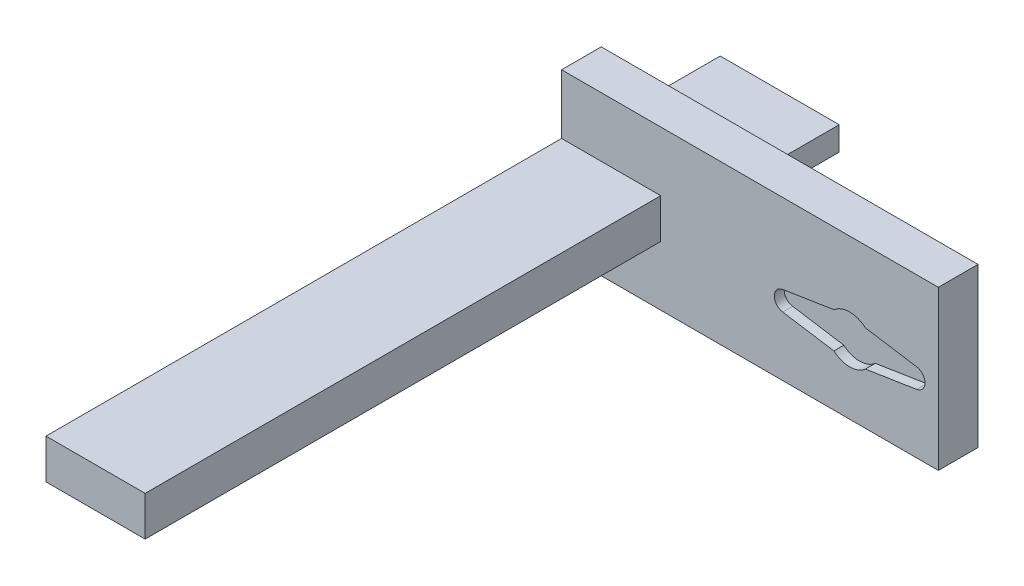
from build123d import *

# Parameters (mm, degrees)
SKETCH3_W            = 45
SKETCH3_H            = 15
BOSS_EXTRUDE1_DEPTH  = 10
CUT_EXTRUDE1_DEPTH   = 2.5
SKETCH11_W           = 45
SKETCH11_H           = 10
BOSS_EXTRUDE5_DEPTH  = 10
SKETCH14_W           = 45
SKETCH14_H           = 10
BOSS_EXTRUDE7_DEPTH  = 15
SKETCH20_W           = 10
SKETCH20_H           = 40
BOSS_EXTRUDE10_DEPTH = 50
SKETCH21_W           = 25
SKETCH21_H           = 10
BOSS_EXTRUDE11_DEPTH = 130
SKETCH22_W           = 30
SKETCH22_H           = 6
BOSS_EXTRUDE12_DEPTH = 30


with BuildPart() as part:
    # Sketch3 → Boss-Extrude1 (new body)
    with BuildSketch(Plane.XY):
        with Locations((-0.138845539, 0.05888455)):
            Rectangle(SKETCH3_W, SKETCH3_H)
    extrude(amount=-BOSS_EXTRUDE1_DEPTH)

    # Sketch2 → Cut-Extrude1 (cut)
    with BuildSketch(Plane.XY):
        with BuildLine():
            Line((-16.888114198, 2.469689731), (-3.968626967, 4.5))
            ThreePointArc((-3.968626967, 4.5), (0, 6), (3.968626967, 4.5))
            Line((3.968626967, 4.5), (16.888114198, 2.469689731))
            ThreePointArc((16.888114198, 2.469689731), (19, 0), (16.888114198, -2.469689731))
            Line((16.888114198, -2.469689731), (3.968626967, -4.5))
            ThreePointArc((3.968626967, -4.5), (0, -6), (-3.968626967, -4.5))
            Line((-3.968626967, -4.5), (-16.888114198, -2.469689731))
            ThreePointArc((-16.888114198, -2.469689731), (-19, 0), (-16.888114198, 2.469689731))
        make_face()
    extrude(amount=-CUT_EXTRUDE1_DEPTH, mode=Mode.SUBTRACT)

    # Sketch11 → Boss-Extrude5 (add)
    with BuildSketch(Plane.XZ.offset(7.44111545)):
        with Locations((-0.138845539, -5)):
            Rectangle(SKETCH11_W, SKETCH11_H)
    extrude(amount=BOSS_EXTRUDE5_DEPTH)

    # Sketch14 → Boss-Extrude7 (add)
    with BuildSketch(Plane(origin=(0, 7.55888455, 0), x_dir=(1, 0, 0), z_dir=(0, 1, 0))):
        with Locations((-0.138845539, 5)):
            Rectangle(SKETCH14_W, SKETCH14_H)
    extrude(amount=BOSS_EXTRUDE7_DEPTH)

    # Sketch20 → Boss-Extrude10 (add)
    with BuildSketch(Plane.ZY.offset(22.638845539)):
        with Locations((-5, 2.55888455)):
            Rectangle(SKETCH20_W, SKETCH20_H)
    extrude(amount=BOSS_EXTRUDE10_DEPTH)

    # Sketch21 → Boss-Extrude11 (add)
    with BuildSketch(Plane.XY):
        with Locations((-60.138845539, 2.55888455)):
            Rectangle(SKETCH21_W, SKETCH21_H)
    extrude(amount=BOSS_EXTRUDE11_DEPTH)

    # Sketch22 → Boss-Extrude12 (add)
    with BuildSketch(Plane(origin=(0, 0, -10), x_dir=(-1, 0, 0), z_dir=(0, 0, -1))):
        with Locations((57.638845539, 2.55888455)):
            Rectangle(SKETCH22_W, SKETCH22_H)
    extrude(amount=BOSS_EXTRUDE12_DEPTH)


solid = part.part
